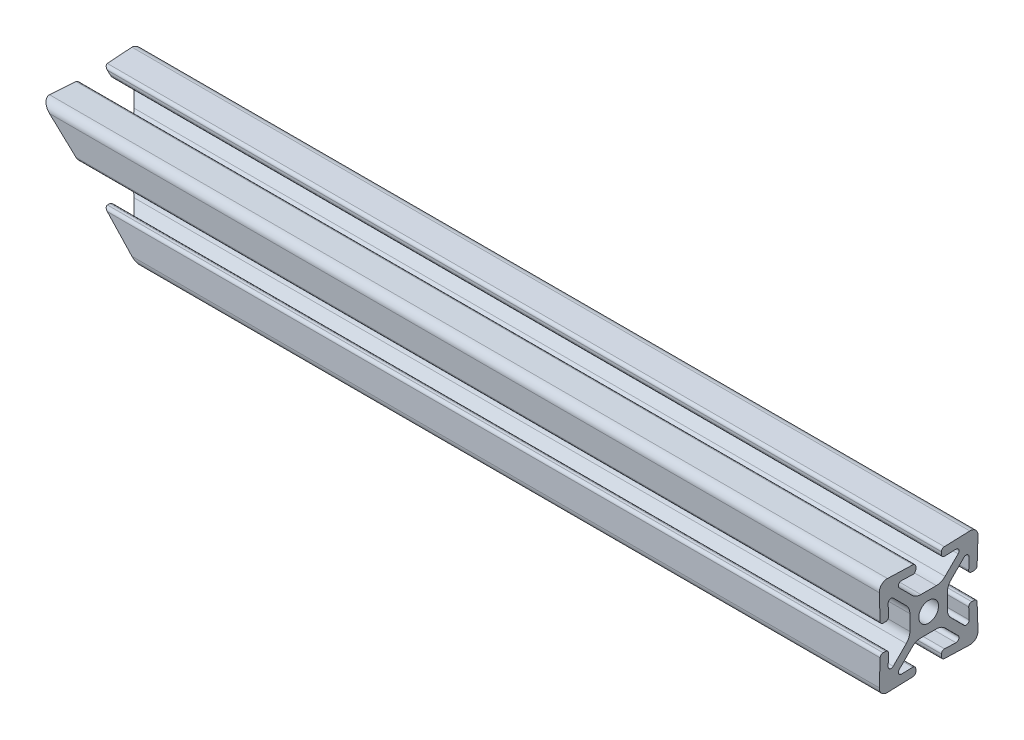
from build123d import *
from OCP.BRepAlgoAPI import BRepAlgoAPI_Cut
from OCP.TopTools import TopTools_ListOfShape

# Parameters (mm, degrees)
BOSS_EXTRUDE1_DEPTH      = 107.763073
BOSS_EXTRUDE1_DEPTH_BACK = 107.763073
CUT_EXTRUDE1_DEPTH       = 112.441765159
CUT_EXTRUDE1_DEPTH_BACK  = 112.441765159


with BuildPart() as part:
    # Sketch3 → Boss-Extrude1 (new, two sides: drawn at the far end of the back side and taken through both)
    with BuildSketch(Plane(origin=(0, 0, 0), x_dir=(0, 0, -1), z_dir=(1, 0, 0)).offset(-BOSS_EXTRUDE1_DEPTH_BACK)):
        with BuildLine():
            Line((0, 4.826), (1.984228399, 4.826))
            ThreePointArc((1.984228399, 4.826), (3.199248297, 5.067682484), (4.229292429, 5.75593597))
            Line((4.229292429, 5.75593597), (7.586577723, 9.113221264))
            ThreePointArc((7.586577723, 9.113221264), (7.746562132, 9.955883421), (7.021168939, 10.413572441))
            Line((7.021168939, 10.413572441), (4.090593416, 10.311234489))
            ThreePointArc((4.090593416, 10.311234489), (3.534670322, 10.524633371), (3.302, 11.072770299))
            Line((3.302, 11.072770299), (3.302, 11.70815736))
            ThreePointArc((3.302, 11.70815736), (3.515863072, 12.237487038), (4.037406584, 12.46969317))
            Line((4.037406584, 12.46969317), (10.597084223, 12.698762161))
            ThreePointArc((10.597084223, 12.698762161), (12.104840979, 12.104840979), (12.698762161, 10.597084223))
            Line((12.698762161, 10.597084223), (12.46969317, 4.037406584))
            ThreePointArc((12.46969317, 4.037406584), (12.237487038, 3.515863072), (11.70815736, 3.302))
            Line((11.70815736, 3.302), (11.072770299, 3.302))
            ThreePointArc((11.072770299, 3.302), (10.524633371, 3.534670322), (10.311234489, 4.090593416))
            Line((10.311234489, 4.090593416), (10.413572441, 7.021168939))
            ThreePointArc((10.413572441, 7.021168939), (9.955883421, 7.746562132), (9.113221264, 7.586577723))
            Line((9.113221264, 7.586577723), (5.75593597, 4.229292429))
            ThreePointArc((5.75593597, 4.229292429), (5.067682484, 3.199248297), (4.826, 1.984228399))
            Line((4.826, 1.984228399), (4.826, 0))
            Line((4.826, 0), (2.54, 0))
            ThreePointArc((2.54, 0), (1.796051224, 1.796051224), (0, 2.54))
            Line((0, 2.54), (0, 4.826))
        make_face()
    extrude(amount=BOSS_EXTRUDE1_DEPTH + BOSS_EXTRUDE1_DEPTH_BACK)

    # Mirror1: part across plane


with BuildPart() as part_1:
    add(part.part)
    add(part.part.mirror(Plane.ZX))

    # Mirror2: part across plane


with BuildPart() as part_2:
    add(part_1.part)
    add(part_1.part.mirror(Plane.XY))


with BuildPart() as cut_extrude1_tool:
    # Sketch5 → Cut-Extrude1 (new, two sides: drawn at the far end of the back side and taken through both)
    with BuildSketch(Plane.XY.offset(12.698762161).offset(-CUT_EXTRUDE1_DEPTH_BACK)):
        Polygon((-551.798462655, -12.7), (-107.763073399, -12.7), (-82.363073399, -12.7), (-107.763073399, 12.7), (-421.743508229, 326.68043483), (-1251.009529162, 644.465856414), (-1381.064483588, 305.085421584), align=None)
    extrude(amount=CUT_EXTRUDE1_DEPTH + CUT_EXTRUDE1_DEPTH_BACK)


with BuildPart() as part_3:
    add(part_2.part)

    # Cut-Extrude1: cut by cut_extrude1_tool, with a tolerance
    cut_extrude1_stock = TopTools_ListOfShape()
    cut_extrude1_stock.Append(part_3.part.wrapped)
    cut_extrude1_tools = TopTools_ListOfShape()
    cut_extrude1_tools.Append(cut_extrude1_tool.part.wrapped)
    cut_extrude1_cut = BRepAlgoAPI_Cut()
    cut_extrude1_cut.SetArguments(cut_extrude1_stock)
    cut_extrude1_cut.SetTools(cut_extrude1_tools)
    cut_extrude1_cut.SetFuzzyValue(0.00001)
    cut_extrude1_cut.Build()
    add(Compound.cast(cut_extrude1_cut.Shape()).solids(), mode=Mode.REPLACE)


solid = part_3.part
